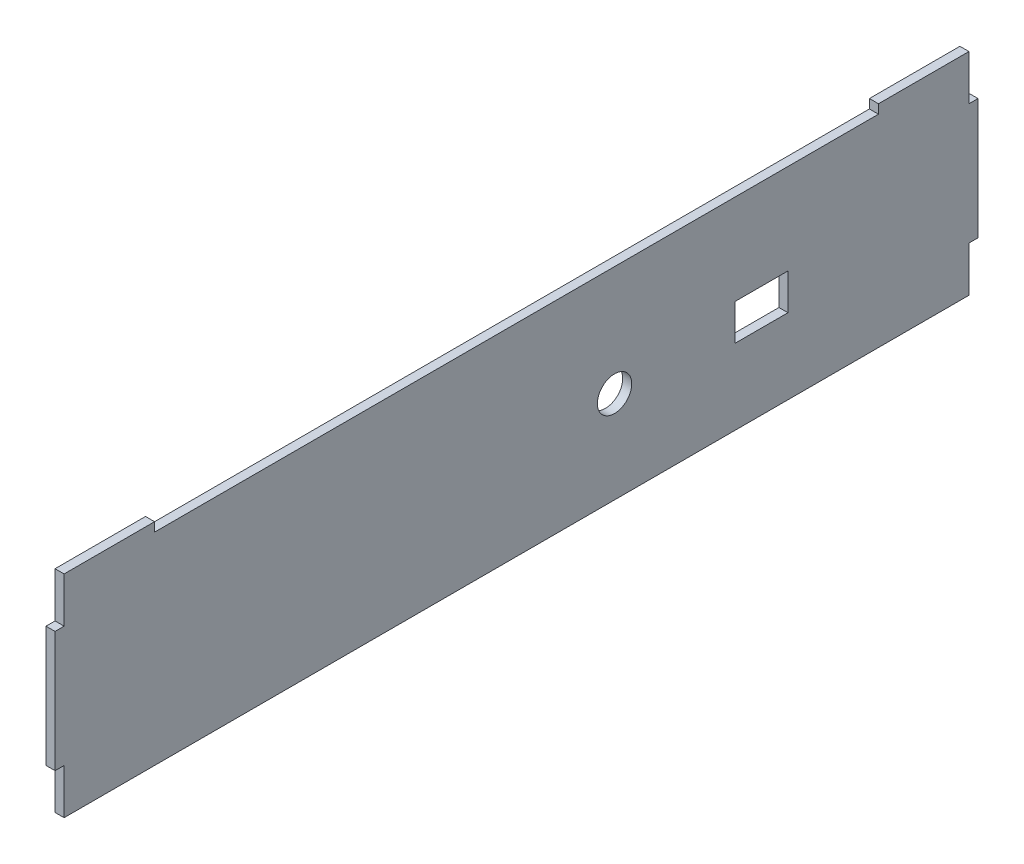
from build123d import *

# Parameters (mm, degrees)
BOSS_EXTRUDE2_DEPTH     = 3
CUT_EXTRUDE1_DEPTH      = 330.393231219
CUT_EXTRUDE1_DEPTH_BACK = 3
SKETCH4_W               = 17.5
SKETCH4_H               = 12
CUT_EXTRUDE2_DEPTH      = 10
SKETCH5_R               = 5.7
CUT_EXTRUDE3_DEPTH      = 10


with BuildPart() as part:
    # Sketch1 → Boss-Extrude2 (new body)
    with BuildSketch(Plane(origin=(0, 0, 0), x_dir=(0, 0, -1), z_dir=(1, 0, 0))):
        Polygon((18.855403516, 70), (318.855403516, 70), (318.855403516, 55), (321.855403516, 55), (321.855403516, 15), (318.855403516, 15), (318.855403516, 0), (18.855403516, 0), (18.855403516, 15), (15.855403516, 15), (15.855403516, 55), (18.855403516, 55), align=None)
    extrude(amount=BOSS_EXTRUDE2_DEPTH)

    # Sketch3 → Cut-Extrude1 (cut, two sides: drawn at the far end of the back side and taken through both)
    with BuildSketch(Plane(origin=(3, 0, 0), x_dir=(0, 0, -1), z_dir=(1, 0, 0)).offset(-CUT_EXTRUDE1_DEPTH_BACK)):
        Polygon((48.855403516, 643.663019898), (48.855403516, 70), (48.855403516, 67), (288.855403516, 67), (288.855403516, 70), (288.855403516, 643.663019898), (288.855403516, 1790.989059693), (48.855403516, 1790.989059693), align=None)
    extrude(amount=CUT_EXTRUDE1_DEPTH + CUT_EXTRUDE1_DEPTH_BACK, mode=Mode.SUBTRACT)

    # Sketch4 → Cut-Extrude2 (cut)
    with BuildSketch(Plane(origin=(3, 0, 0), x_dir=(0, 0, -1), z_dir=(1, 0, 0))):
        with Locations((250.105403516, 31)):
            Rectangle(SKETCH4_W, SKETCH4_H)
    extrude(amount=-CUT_EXTRUDE2_DEPTH, mode=Mode.SUBTRACT)

    # Sketch5 → Cut-Extrude3 (cut)
    with BuildSketch(Plane(origin=(3, 0, 0), x_dir=(0, 0, -1), z_dir=(1, 0, 0))):
        with Locations((201.355403516, 30.5)):
            Circle(SKETCH5_R)
    extrude(amount=-CUT_EXTRUDE3_DEPTH, mode=Mode.SUBTRACT)


solid = part.part
